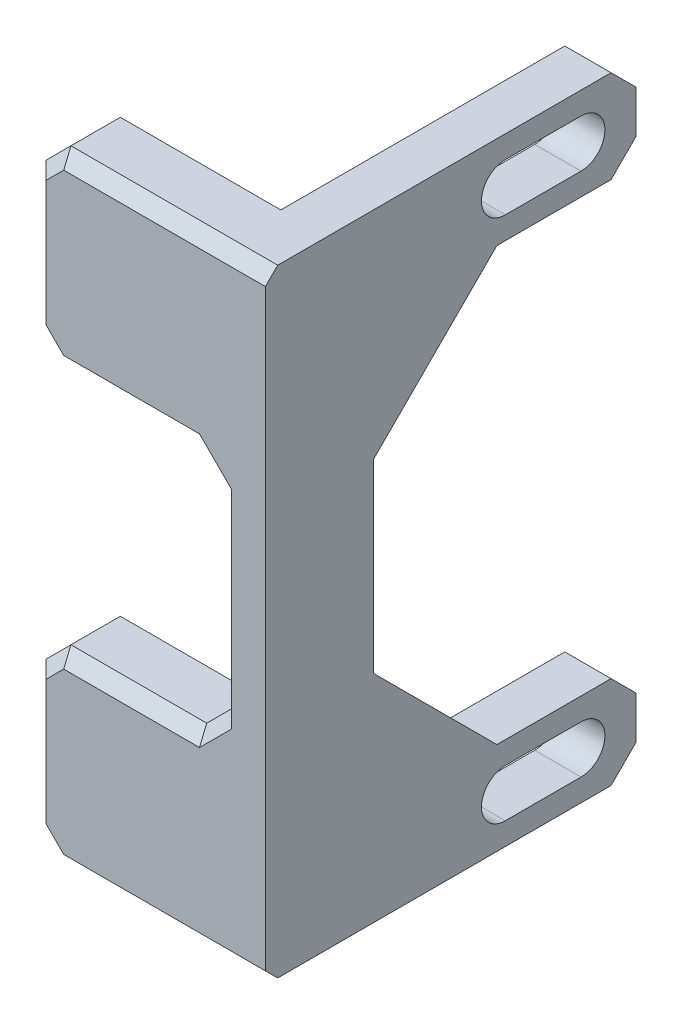
from build123d import *

# Parameters (mm, degrees)
SKETCH1_W                 = 6.35
SKETCH1_H                 = 63.5
BOSS_EXTRUDE1_DEPTH       = 19.05
BOSS_EXTRUDE2_DEPTH       = 4.7625
SKETCH4_W                 = 19.05
SKETCH4_H                 = 25.4
CUT_EXTRUDE1_DEPTH        = 6.35
CHAMFER1_SIZE             = 12.7
CHAMFER2_SIZE             = 2.54
CHAMFER3_SIZE             = 1.27
F_8_CLEARANCE_SLOT1_DEPTH = 4.7625


# Read off the part's stored shape, not the designer's step: #8 Clearance Slot1
with BuildPart() as part:
    # Sketch1 → Boss-Extrude1 (new body)
    with BuildSketch(Plane(origin=(0, 0, 0), x_dir=(0, 0, -1), z_dir=(1, 0, 0))):
        Rectangle(SKETCH1_W, SKETCH1_H)
    extrude(amount=-BOSS_EXTRUDE1_DEPTH)

    # Sketch2 → Boss-Extrude2 (add)
    with BuildSketch(Plane(origin=(0, 0, 0), x_dir=(0, 0, -1), z_dir=(1, 0, 0))):
        Polygon((-3.175, 31.75), (34.925, 31.75), (34.925, 22.225), (7.9375, 22.225), (7.9375, -22.225), (34.925, -22.225), (34.925, -31.75), (-3.175, -31.75), align=None)
    extrude(amount=BOSS_EXTRUDE2_DEPTH)

    # Sketch4 → Cut-Extrude1 (cut)
    with BuildSketch(Plane.XY.offset(3.175)):
        with Locations((-9.525, 0)):
            Rectangle(SKETCH4_W, SKETCH4_H)
    extrude(amount=-CUT_EXTRUDE1_DEPTH, mode=Mode.SUBTRACT)

    # Chamfer1
    chamfer1_edges = [part.edges().sort_by_distance(p)[0] for p in [
        (2.38125, -22.225, -7.9375),
        (2.38125, 22.225, -7.9375),
    ]]
    chamfer(chamfer1_edges, length=CHAMFER1_SIZE)

    # Chamfer2
    chamfer2_edges = [part.edges().sort_by_distance(p)[0] for p in [
        (-19.05, 31.75, 0),
        (2.38125, -31.75, -34.925),
        (2.38125, -22.225, -34.925),
        (2.38125, 22.225, -34.925),
        (2.38125, 31.75, -34.925),
        (-19.05, -12.7, 0),
        (-19.05, 12.7, 0),
        (0, 12.7, 0),
        (0, -12.7, 0),
        (-19.05, -31.75, 0),
    ]]
    chamfer(chamfer2_edges, length=CHAMFER2_SIZE)

    # Chamfer3
    chamfer3_edges = [part.edges().sort_by_distance(p)[0] for p in [
        (-9.525, 12.7, 3.175),
        (0, 0, 3.175),
        (-9.525, -12.7, 3.175),
        (-19.05, -22.225, 3.175),
        (-5.87375, -31.75, 3.175),
        (-5.87375, 31.75, 3.175),
        (-19.05, 22.225, 3.175),
        (-17.78, 30.48, 3.175),
        (-17.78, -30.48, 3.175),
        (-17.78, 13.97, 3.175),
        (-17.78, -13.97, 3.175),
        (-1.27, 11.43, 3.175),
        (-1.27, -11.43, 3.175),
    ]]
    chamfer(chamfer3_edges, length=CHAMFER3_SIZE)

    # #8 Clearance Slot1 outline → #8 Clearance Slot1 (cut)
    with BuildSketch(Plane.YZ):
        with BuildLine():
            Line((-24.53005, -29.29255), (-24.53005, -21.50745))
            ThreePointArc((-24.53005, -21.50745), (-26.9875, -19.05), (-29.44495, -21.50745))
            Line((-29.44495, -21.50745), (-29.44495, -29.29255))
            ThreePointArc((-29.44495, -29.29255), (-26.9875, -31.75), (-24.53005, -29.29255))
        make_face()
        with BuildLine():
            Line((24.53005, -21.50745), (24.53005, -29.29255))
            ThreePointArc((24.53005, -29.29255), (26.9875, -31.75), (29.44495, -29.29255))
            Line((29.44495, -29.29255), (29.44495, -21.50745))
            ThreePointArc((29.44495, -21.50745), (26.9875, -19.05), (24.53005, -21.50745))
        make_face()
    extrude(amount=F_8_CLEARANCE_SLOT1_DEPTH, mode=Mode.SUBTRACT)


solid = part.part
